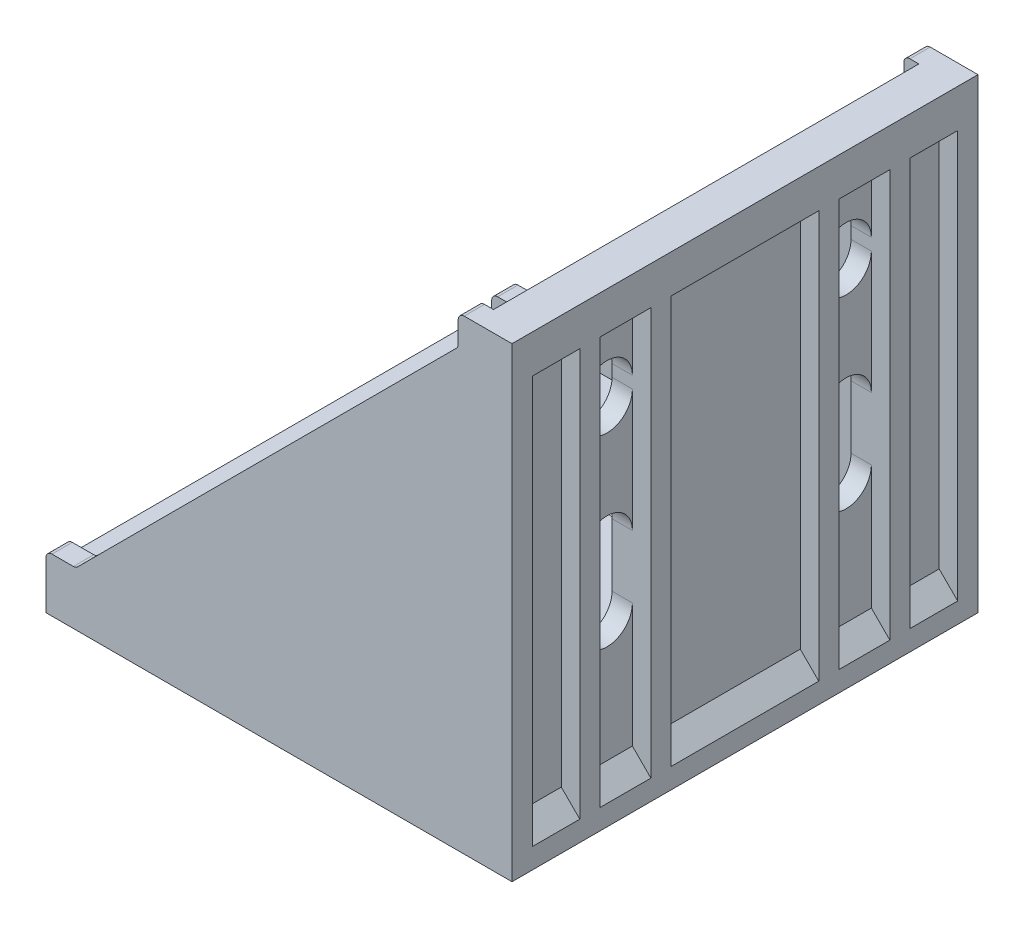
from build123d import *

# Parameters (mm, degrees)
BOSS_EXTRUDE1_DEPTH      = 39
CUT_EXTRUDE1_DEPTH       = 35.6
CUT_EXTRUDE1_DEPTH_BACK  = 35.6
SKETCH2_W                = 71.5
SKETCH2_H                = 71.5
CUT_EXTRUDE2_DEPTH       = 10
SKETCH5_W                = 68.2
SKETCH5_H                = 8.5
SKETCH5_H_2              = 7.95
SKETCH5_H_3              = 24.7
CUT_EXTRUDE3_DEPTH       = 3.1
CHAMFER1_SIZE            = 3.1
CHAMFER1_OF_MIRROR1_SIZE = 3.1
FILLET1_R                = 1


with BuildPart() as part:
    # Sketch1 → Boss-Extrude1 (new, symmetric)
    with BuildSketch(Plane.XY):
        Polygon((-78, 0), (0, 0), (0, 78), (-9, 78), (-9, 73), (-73, 9), (-78, 9), align=None)
    extrude(amount=BOSS_EXTRUDE1_DEPTH, both=True)

    # Sketch2 → Cut-Extrude1 (cut, two sides: drawn at the far end of the back side and taken through both)
    with BuildSketch(Plane.XY.offset(-CUT_EXTRUDE1_DEPTH_BACK)):
        with Locations((-42.25, 42.25)):
            Rectangle(SKETCH2_W, SKETCH2_H)
    extrude(amount=CUT_EXTRUDE1_DEPTH + CUT_EXTRUDE1_DEPTH_BACK, mode=Mode.SUBTRACT)

    # Sketch3 → Cut-Extrude2 (cut)
    with BuildSketch(Plane(origin=(0, 6.5, 0), x_dir=(1, 0, 0), z_dir=(0, 1, 0))):
        with BuildLine():
            Line((-27.25, -24.25), (-37.75, -24.25))
            ThreePointArc((-37.75, -24.25), (-42, -20), (-37.75, -15.75))
            Line((-37.75, -15.75), (-27.25, -15.75))
            ThreePointArc((-27.25, -15.75), (-23, -20), (-27.25, -24.25))
        make_face()
        with BuildLine():
            Line((-60.25, -15.75), (-58.25, -15.75))
            ThreePointArc((-58.25, -15.75), (-54, -20), (-58.25, -24.25))
            Line((-58.25, -24.25), (-60.25, -24.25))
            ThreePointArc((-60.25, -24.25), (-64.5, -20), (-60.25, -15.75))
        make_face()
        with BuildLine():
            Line((-27.25, 24.25), (-37.75, 24.25))
            ThreePointArc((-37.75, 24.25), (-42, 20), (-37.75, 15.75))
            Line((-37.75, 15.75), (-27.25, 15.75))
            ThreePointArc((-27.25, 15.75), (-23, 20), (-27.25, 24.25))
        make_face()
        with BuildLine():
            Line((-60.25, 15.75), (-58.25, 15.75))
            ThreePointArc((-58.25, 15.75), (-54, 20), (-58.25, 24.25))
            Line((-58.25, 24.25), (-60.25, 24.25))
            ThreePointArc((-60.25, 24.25), (-64.5, 20), (-60.25, 15.75))
        make_face()
    cut_extrude2 = extrude(amount=-CUT_EXTRUDE2_DEPTH, mode=Mode.SUBTRACT)

    # Sketch5 → Cut-Extrude3 (cut)
    with BuildSketch(Plane.XZ):
        with Locations((-37.5, 20)):
            Rectangle(SKETCH5_W, SKETCH5_H)
        with Locations((-37.5, 31.625)):
            Rectangle(SKETCH5_W, SKETCH5_H_2)
        with Locations((-37.5, 0)):
            Rectangle(SKETCH5_W, SKETCH5_H_3)
        with Locations((-37.5, -31.625)):
            Rectangle(SKETCH5_W, SKETCH5_H_2)
        with Locations((-37.5, -20)):
            Rectangle(SKETCH5_W, SKETCH5_H)
    cut_extrude3 = extrude(amount=-CUT_EXTRUDE3_DEPTH, mode=Mode.SUBTRACT)

    # Chamfer1
    chamfer1_edges = [part.edges().sort_by_distance(p)[0] for p in [
        (-3.4, 3.1, 31.625),
        (-3.4, 3.1, 20),
        (-3.4, 3.1, 0),
        (-3.4, 3.1, -20),
        (-3.4, 3.1, -31.625),
    ]]
    chamfer(chamfer1_edges, length=CHAMFER1_SIZE - 0.0001)  # a hair under: the kernel refuses the full size

    # Mirror1: Cut-Extrude2, Cut-Extrude3 across plane
    add(cut_extrude2.mirror(Plane(origin=(0, 0, 0), x_dir=(0, 0, 1), z_dir=(-0.7071067811865474, -0.7071067811865477, 0))), mode=Mode.SUBTRACT)
    add(cut_extrude3.mirror(Plane(origin=(0, 0, 0), x_dir=(0, 0, 1), z_dir=(-0.7071067811865474, -0.7071067811865477, 0))), mode=Mode.SUBTRACT)

    # Chamfer1 of Mirror1
    chamfer1_of_mirror1_edges = [part.edges().sort_by_distance(p)[0] for p in [
        (-3.1, 3.4, 31.625),
        (-3.1, 3.4, 20),
        (-3.1, 3.4, 0),
        (-3.1, 3.4, -20),
        (-3.1, 3.4, -31.625),
    ]]
    chamfer(chamfer1_of_mirror1_edges, length=CHAMFER1_OF_MIRROR1_SIZE - 0.0001)  # a hair under: the kernel refuses the full size

    # Fillet1
    fillet1_edges = [part.edges().sort_by_distance(p)[0] for p in [
        (-78, 9, 37.3),
        (-73, 9, 37.3),
        (-9, 73, 37.3),
        (-9, 78, 37.3),
        (-78, 9, -37.3),
        (-73, 9, -37.3),
        (-9, 73, -37.3),
        (-9, 78, -37.3),
    ]]
    fillet(fillet1_edges, radius=FILLET1_R)


solid = part.part
